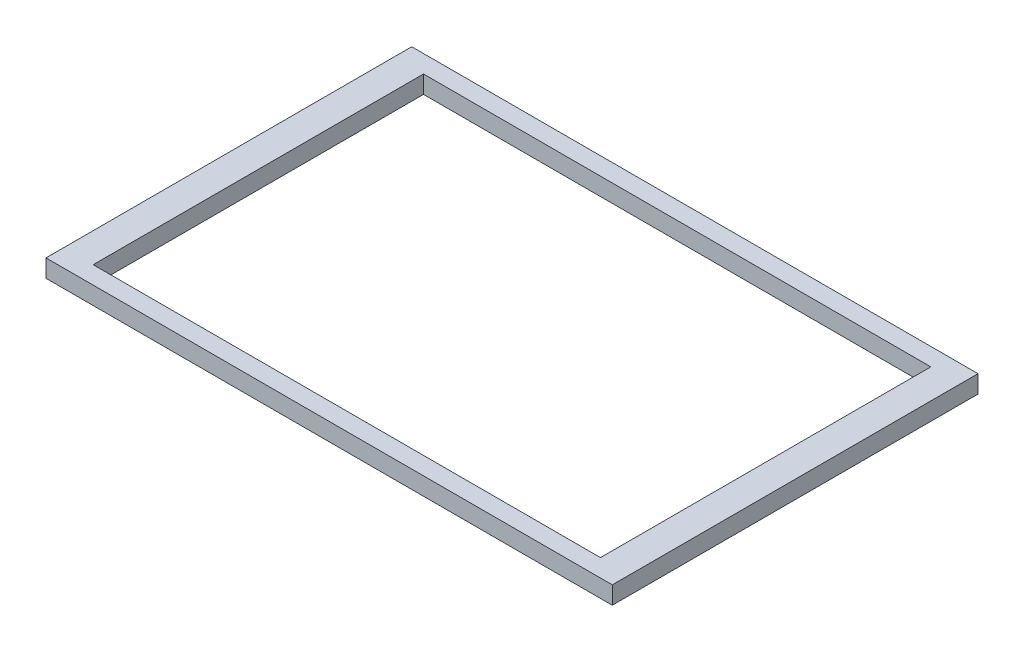
from build123d import *

# Parameters (mm, degrees)
SKETCH1_W           = 96
SKETCH1_H           = 62
SKETCH1_W_2         = 86
SKETCH1_H_2         = 56
BOSS_EXTRUDE1_DEPTH = 3


with BuildPart() as part:
    # Sketch1 → Boss-Extrude1 (new body)
    with BuildSketch(Plane(origin=(0, 0, 0), x_dir=(1, 0, 0), z_dir=(0, 1, 0))):
        Rectangle(SKETCH1_W, SKETCH1_H)
        Rectangle(SKETCH1_W_2, SKETCH1_H_2, mode=Mode.SUBTRACT)
    extrude(amount=BOSS_EXTRUDE1_DEPTH)


solid = part.part
